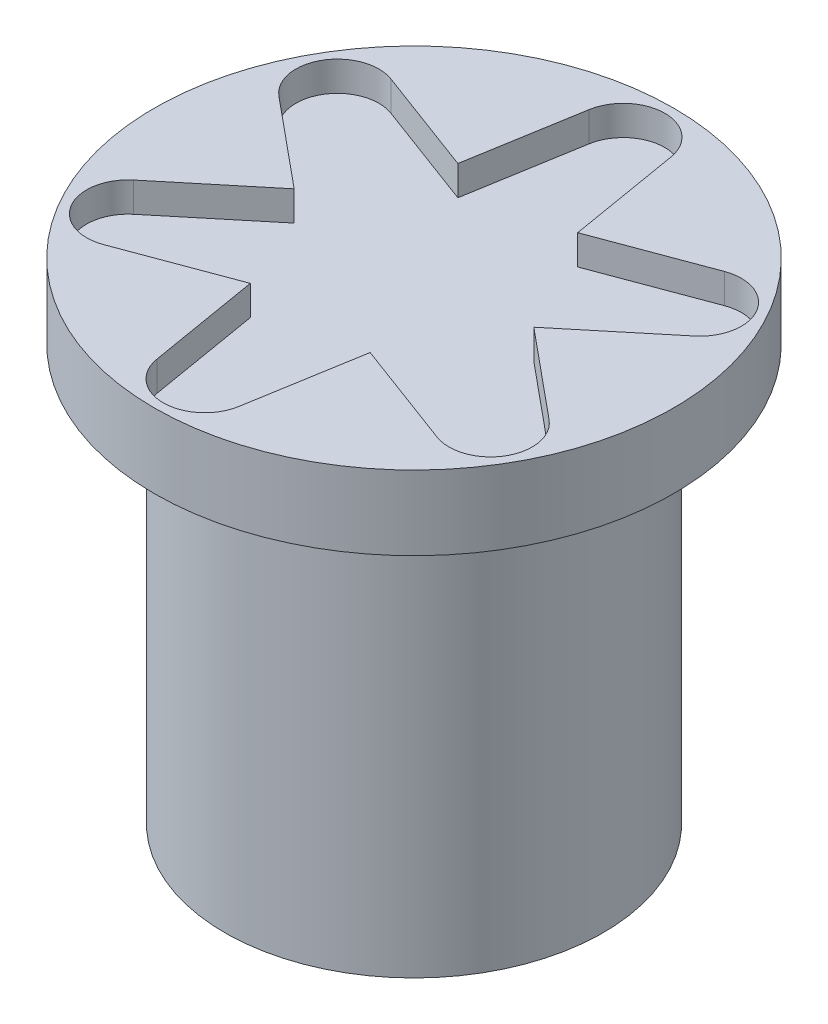
from build123d import *

# Parameters (mm, degrees)
SKETCH1_W           = 7.5
SKETCH1_H           = 7.5
BOSS_EXTRUDE1_DEPTH = 3
BOSS_EXTRUDE2_START = 25
BOSS_EXTRUDE2_DEPTH = 25
SKETCH3_R           = 17.5
BOSS_EXTRUDE3_DEPTH = 5
CUT_EXTRUDE1_DEPTH  = 2
CIRPATTERN1_COUNT   = 6


with BuildPart() as part:
    # Sketch1 → Boss-Extrude1 (new body)
    with BuildSketch(Plane(origin=(0, 0, 0), x_dir=(1, 0, 0), z_dir=(0, 1, 0))):
        with BuildLine():
            Line((4, 12.106300013), (4, 7.782191208))
            ThreePointArc((4, 7.782191208), (-6.187184335, 6.187184335), (-7.782191208, -4))
            Line((-7.782191208, -4), (-12.106300013, -4))
            ThreePointArc((-12.106300013, -4), (9.01561146, -9.01561146), (4, 12.106300013))
        make_face()
        Rectangle(SKETCH1_W, SKETCH1_H, mode=Mode.SUBTRACT)
    extrude(amount=-BOSS_EXTRUDE1_DEPTH)

    # Sketch2 → Boss-Extrude2 (add)
    with BuildSketch(Plane(origin=(0, 0, 0), x_dir=(1, 0, 0), z_dir=(0, 1, 0)).offset(BOSS_EXTRUDE2_START)):
        with BuildLine():
            Line((-8.891709622, -4), (-12.106300013, -4))
            ThreePointArc((-12.106300013, -4), (9.01561146, -9.01561146), (4, 12.106300013))
            Line((4, 12.106300013), (4, 8.891709622))
            ThreePointArc((4, 8.891709622), (6.894291117, -6.894291117), (-8.891709622, -4))
        make_face()
    extrude(amount=-BOSS_EXTRUDE2_DEPTH)

    # Sketch3 → Boss-Extrude3 (add)
    with BuildSketch(Plane(origin=(0, 25, 0), x_dir=(1, 0, 0), z_dir=(0, 1, 0))):
        Circle(SKETCH3_R)
    extrude(amount=BOSS_EXTRUDE3_DEPTH)

    # Sketch4 → Cut-Extrude1 (cut)
    with BuildSketch(Plane(origin=(0, 30, 0), x_dir=(1, 0, 0), z_dir=(0, 1, 0))):
        with BuildLine():
            Line((-2.761058064, 14.565358319), (-4.097301236, 6.637177305))
            ThreePointArc((-4.097301236, 6.637177305), (0, -7.8), (4.097301236, 6.637177305))
            Line((4.097301236, 6.637177305), (2.761058064, 14.565358319))
            ThreePointArc((2.761058064, 14.565358319), (0, 16.9), (-2.761058064, 14.565358319))
        make_face()
    cut_extrude1 = extrude(amount=-CUT_EXTRUDE1_DEPTH, mode=Mode.SUBTRACT)

    # CirPattern1: Cut-Extrude1 ×6 about axis
    cirpattern1_axis = Axis((0, 28, 0), (0, 1, 0))
    for i in range(1, CIRPATTERN1_COUNT):
        add(cut_extrude1.rotate(cirpattern1_axis, i * 360 / CIRPATTERN1_COUNT), mode=Mode.SUBTRACT)


solid = part.part
